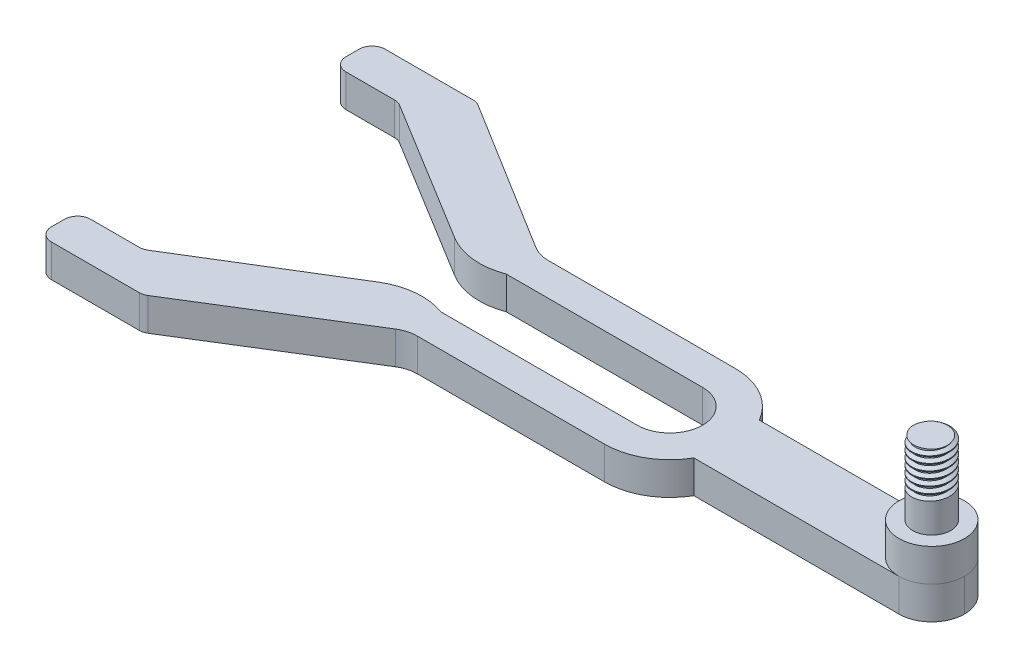
from build123d import *

# Parameters (mm, degrees)
SKETCH_1_W          = 50
SKETCH_1_H          = 10
EXTRUDE_1_DEPTH     = 5
SKETCH_2_R          = 2.9
EXTRUDE_2_DEPTH     = 16
SKETCH_3_R          = 5
EXTRUDE_3_DEPTH     = 5
FILLET_1_R          = 5
THREAD_1_PITCH      = 1
EXTRUDE_4_DEPTH     = 5
CUT_EXTRUDE_2_DEPTH = 5
SKETCH_14_W         = 20
SKETCH_14_H         = 10
CUT_EXTRUDE_3_DEPTH = 5
SKETCH_15_W         = 20
SKETCH_15_H         = 5
EXTRUDE_5_DEPTH     = 5
EXTRUDE_6_DEPTH     = 5
FILLET_4_R          = 5
SKETCH_19_W         = 10
SKETCH_19_H         = 6
EXTRUDE_7_DEPTH     = 5
FILLET_5_R          = 10
FILLET_6_R          = 2


# Some blends are built 0.0001 mm under size
with BuildPart() as part:
    # Sketch 1 → 凸台-拉伸1 (new body)
    with BuildSketch(Plane(origin=(0, 0, 0), x_dir=(1, 0, 0), z_dir=(0, 1, 0))):
        Rectangle(SKETCH_1_W, SKETCH_1_H)
    extrude(amount=EXTRUDE_1_DEPTH)

    # 草图2 → 凸台-拉伸2 (add)
    with BuildSketch(Plane(origin=(0, 5, 0), x_dir=(1, 0, 0), z_dir=(0, 1, 0))):
        with Locations(Location((20, 0, 0), (0, 0, 270))):
            Circle(SKETCH_2_R)
    extrude(amount=EXTRUDE_2_DEPTH)

    # 草图3 → 凸台-拉伸3 (add)
    with BuildSketch(Plane(origin=(0, 5, 0), x_dir=(1, 0, 0), z_dir=(0, 1, 0))):
        with Locations(Location((20, 0, 0), (0, 0, 270))):
            Circle(SKETCH_3_R)
    extrude(amount=EXTRUDE_3_DEPTH)

    # 圆角1
    fillet_1_edges = [part.edges().sort_by_distance(p)[0] for p in [
        (25, 2.5, 5),
        (25, 2.5, -5),
    ]]
    fillet(fillet_1_edges, radius=FILLET_1_R - 0.0001)  # a hair under: the kernel refuses the full size

    # 螺纹线1: the profile of Sketch 1 2 profile screwed along a right-hand helix of 7 turns, 8 arcs to a turn; built about Z, then put on its axis
    thread_1_z = Axis((0, 0, 0), (0, 0, 1))
    thread_1_corners = [(2.9003, 0, -0.000173205), (2.9003, 0, 0.875173202), (2.358734125, 0, 0.562499999), (2.358734125, 0, 0.312499999)]
    with BuildLine(mode=Mode.PRIVATE) as thread_1_profile:
        Line(thread_1_corners[0], thread_1_corners[1])
        Line(thread_1_corners[1], thread_1_corners[2])
        Line(thread_1_corners[2], thread_1_corners[3])
        Line(thread_1_corners[3], thread_1_corners[0])
    thread_1_cap = Face(thread_1_profile.wire())
    thread_1_turn_angles = [0, 22.5, 45, 67.5, 90, 112.5, 135, 157.5, 180, 202.5, 225, 247.5, 270, 292.5, 315, 337.5, 360]
    thread_1_turn_weights = [1, 0.9238795325112867, 1, 0.9238795325112867, 1, 0.9238795325112867, 1, 0.9238795325112867, 1, 0.9238795325112867, 1, 0.9238795325112867, 1, 0.9238795325112867, 1, 0.9238795325112867, 1]
    thread_1_turn_rails = [Edge.make_bspline([Vector(p[0], p[1], 0).rotate(thread_1_z, thread_1_turn_angles[k]) / thread_1_turn_weights[k] + Vector(0, 0, p[2] + THREAD_1_PITCH * thread_1_turn_angles[k] / 360) for k in range(17)], [0, 0, 0, 1, 1, 2, 2, 3, 3, 4, 4, 5, 5, 6, 6, 7, 7, 8, 8, 8], 2, thread_1_turn_weights) for p in thread_1_corners]
    thread_1_turn_sides = [Face.make_surface_from_curves(thread_1_turn_rails[p[0]], thread_1_turn_rails[p[1]]) for p in [(0, 1), (1, 2), (2, 3), (3, 0)]]
    thread_1 = Plane(origin=(20, 22, 0), x_dir=(-1, 0, 0), z_dir=(0, -1, 0)) * Solid(Shell([*[p.moved(Location((0, 0, THREAD_1_PITCH * i))) for i in range(7) for p in thread_1_turn_sides], thread_1_cap, thread_1_cap.rotate(thread_1_z, 2520).moved(Location((0, 0, THREAD_1_PITCH * 2520 / 360)))]))
    add(thread_1, mode=Mode.SUBTRACT)

    # 草图11 → 凸台-拉伸4 (add)
    with BuildSketch(Plane(origin=(0, 5, 0), x_dir=(1, 0, 0), z_dir=(0, 1, 0))):
        with BuildLine():
            Line((-30, 10), (-20, 10))
            ThreePointArc((-20, 10), (-10, 0), (-20, -10))
            Line((-20, -10), (-30, -10))
            ThreePointArc((-30, -10), (-40, 0), (-30, 10))
        make_face()
    extrude(amount=-EXTRUDE_4_DEPTH)

    # 草图13 → 切除-拉伸2 (cut)
    with BuildSketch(Plane(origin=(0, 5, 0), x_dir=(1, 0, 0), z_dir=(0, 1, 0))):
        with BuildLine():
            Line((-20, -5), (-30, -5))
            ThreePointArc((-30, -5), (-35, 0), (-30, 5))
            Line((-30, 5), (-20, 5))
            ThreePointArc((-20, 5), (-15, 0), (-20, -5))
        make_face()
    extrude(amount=-CUT_EXTRUDE_2_DEPTH, mode=Mode.SUBTRACT)

    # 草图14 → 切除-拉伸3 (cut)
    with BuildSketch(Plane(origin=(0, 5, 0), x_dir=(1, 0, 0), z_dir=(0, 1, 0))):
        with Locations((-40, 0)):
            Rectangle(SKETCH_14_W, SKETCH_14_H)
    extrude(amount=-CUT_EXTRUDE_3_DEPTH, mode=Mode.SUBTRACT)

    # 草图15 → 凸台-拉伸5 (add)
    with BuildSketch(Plane(origin=(0, 5, 0), x_dir=(1, 0, 0), z_dir=(0, 1, 0))):
        with Locations((-40, 7.5)):
            Rectangle(SKETCH_15_W, SKETCH_15_H)
        with Locations((-40, -7.5)):
            Rectangle(SKETCH_15_W, SKETCH_15_H)
    extrude(amount=-EXTRUDE_5_DEPTH)

    # 草图16 → 凸台-拉伸6 (add)
    with BuildSketch(Plane(origin=(0, 5, 0), x_dir=(1, 0, 0), z_dir=(0, 1, 0))):
        Polygon((-50, 10), (-75, 25.5), (-81, 25.5), (-81, 19.5), (-50, 0.5), (-50, 5), align=None)
    extrude_6 = extrude(amount=-EXTRUDE_6_DEPTH)

    # 镜向1: 凸台-拉伸6 across plane
    add(extrude_6.mirror(Plane.XY))

    # 圆角4
    fillet_4_edges = [part.edges().sort_by_distance(p)[0] for p in [
        (-50, 2.5, -10),
        (-50, 2.5, 10),
    ]]
    fillet(fillet_4_edges, radius=FILLET_4_R)

    # 草图19 → 凸台-拉伸7 (add)
    with BuildSketch(Plane(origin=(0, 5, 0), x_dir=(1, 0, 0), z_dir=(0, 1, 0))):
        with Locations((-86, 22.5)):
            Rectangle(SKETCH_19_W, SKETCH_19_H)
        with Locations((-86, -22.5)):
            Rectangle(SKETCH_19_W, SKETCH_19_H)
    extrude(amount=-EXTRUDE_7_DEPTH)

    # 圆角5
    # the kernel refuses this fillet: 10 mm, written as the material it takes off along each edge
    with BuildSketch(Plane(origin=(-50, 30.566033877, 0.5), x_dir=(0, 0, 1), z_dir=(0, -1, 0))) as fillet_5_piece_1:
        with BuildLine():
            CenterArc((13.869948234, 3.493432422), FILLET_5_R, 148.495733281, 51.95141686)
            Line((5.34393571, 8.719053001), (5.17341546, 8.823565413))
            Line((5.17341546, 8.823565413), (-0.17052025, 0.104512412))
            Line((-0.17052025, 0.104512412), (0, -0.2))
            ThreePointArc((0, -0.2), (2.25, -0.2), (4.312601035, -0.069868648))
            Line((4.312601035, -0.069868648), (4.5, 0))
        make_face()
    extrude(amount=56.132067753, mode=Mode.SUBTRACT)
    with BuildSketch(Plane(origin=(-50, 30.566033877, -0.5), x_dir=(-0.8526012524109428, 0, -0.5225620579292874), z_dir=(0, -1, 0))) as fillet_5_piece_2:
        with BuildLine():
            CenterArc((10.226413551, 10), FILLET_5_R, 218.04858314, 51.95141686)
            Line((2.351529261, 3.836705636), (2.194031575, 3.713439749))
            ThreePointArc((2.194031575, 3.713439749), (1.00524438, 2.02286523), (-0.17052025, 0.104512412))
            Line((-0.17052025, 0.104512412), (0, -0.2))
            Line((0, -0.2), (10.226413551, -0.2))
            Line((10.226413551, -0.2), (10.226413551, 0))
        make_face()
    extrude(amount=56.132067753, mode=Mode.SUBTRACT)

    # 圆角6
    fillet_6_edges = [part.edges().sort_by_distance(p)[0] for p in [
        (-81, 2.5, -19.5),
        (-75, 2.5, -25.5),
        (-75, 2.5, 25.5),
        (-81, 2.5, 19.5),
        (-91, 2.5, -19.5),
        (-91, 2.5, -25.5),
        (-91, 2.5, 25.5),
        (-91, 2.5, 19.5),
    ]]
    fillet(fillet_6_edges, radius=FILLET_6_R)


solid = part.part
